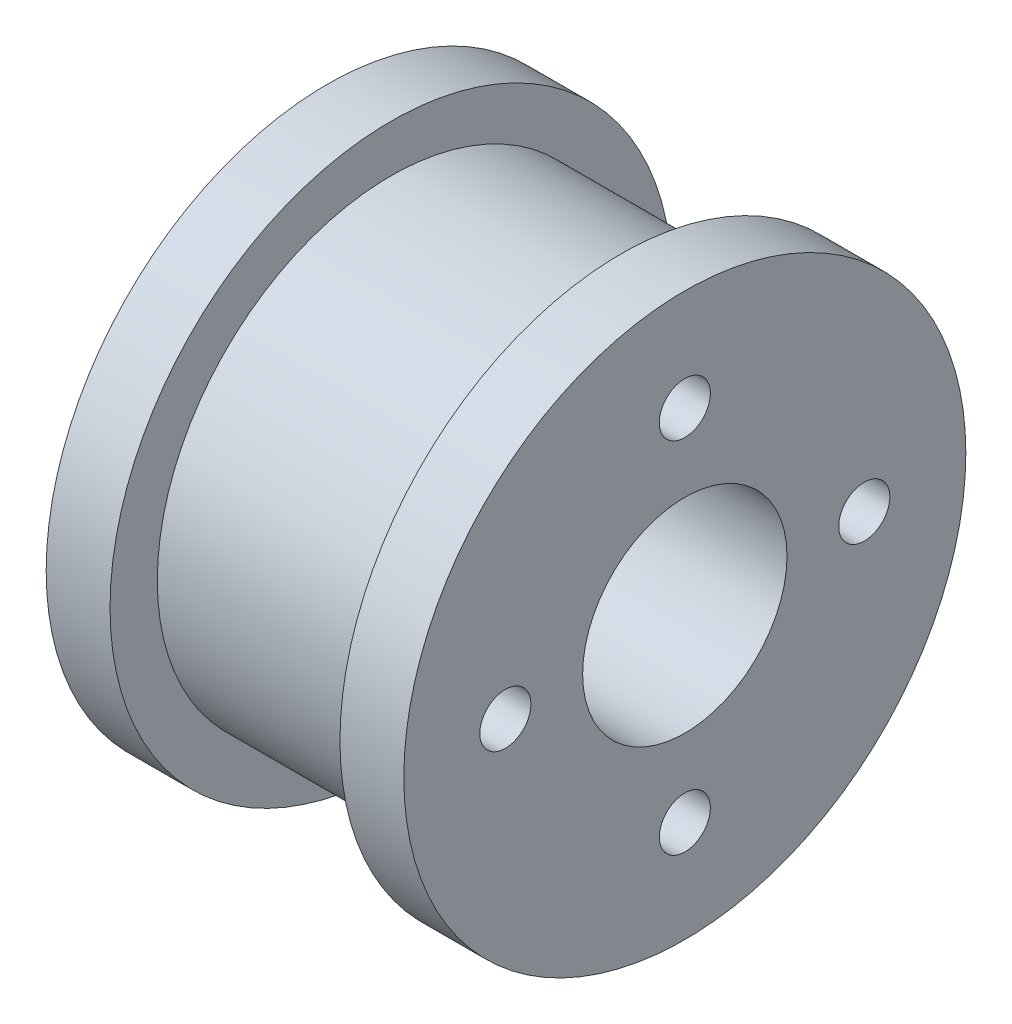
from build123d import *

# Parameters (mm, degrees)
SKETCH1_R           = 11
BOSS_EXTRUDE1_DEPTH = 2.5
SKETCH2_R           = 9.15
BOSS_EXTRUDE2_DEPTH = 9
SKETCH3_R           = 11
BOSS_EXTRUDE3_DEPTH = 2.5
SKETCH4_R           = 4
CUT_EXTRUDE1_DEPTH  = 21.928449536
CUT_EXTRUDE2_REACH  = 22.928
SKETCH5_R           = 1


with BuildPart() as part:
    # Sketch1 → Boss-Extrude1 (new body)
    with BuildSketch(Plane(origin=(0, 0, 0), x_dir=(0, 0, -1), z_dir=(1, 0, 0))):
        Circle(SKETCH1_R)
    extrude(amount=BOSS_EXTRUDE1_DEPTH)

    # Sketch2 → Boss-Extrude2 (add)
    with BuildSketch(Plane(origin=(2.5, 0, 0), x_dir=(0, 0, -1), z_dir=(1, 0, 0))):
        Circle(SKETCH2_R)
    extrude(amount=BOSS_EXTRUDE2_DEPTH)

    # Sketch3 → Boss-Extrude3 (add)
    with BuildSketch(Plane(origin=(11.5, 0, 0), x_dir=(0, 0, -1), z_dir=(1, 0, 0))):
        Circle(SKETCH3_R)
    extrude(amount=BOSS_EXTRUDE3_DEPTH)

    # Sketch4 → Cut-Extrude1 (cut, through all)
    with BuildSketch(Plane(origin=(14, 0, 0), x_dir=(0, 0, -1), z_dir=(1, 0, 0))):
        Circle(SKETCH4_R)
    extrude(amount=-CUT_EXTRUDE1_DEPTH, mode=Mode.SUBTRACT)

    # Sketch5 → Cut-Extrude2 (cut, up to next)
    with BuildSketch(Plane(origin=(14, 0, 0), x_dir=(0, 0, -1), z_dir=(1, 0, 0)), mode=Mode.PRIVATE) as cut_extrude2_sk1:
        with Locations((0, 7.025)):
            Circle(SKETCH5_R)
    cut_extrude2_tool1 = extrude(cut_extrude2_sk1.sketch, amount=-CUT_EXTRUDE2_REACH, mode=Mode.PRIVATE) & part.part
    # Sketch5 → Cut-Extrude2 (cut, up to next)
    with BuildSketch(Plane(origin=(14, 0, 0), x_dir=(0, 0, -1), z_dir=(1, 0, 0)), mode=Mode.PRIVATE) as cut_extrude2_sk2:
        with Locations((7.025, 0)):
            Circle(SKETCH5_R)
    cut_extrude2_tool2 = extrude(cut_extrude2_sk2.sketch, amount=-CUT_EXTRUDE2_REACH, mode=Mode.PRIVATE) & part.part
    # Sketch5 → Cut-Extrude2 (cut, up to next)
    with BuildSketch(Plane(origin=(14, 0, 0), x_dir=(0, 0, -1), z_dir=(1, 0, 0)), mode=Mode.PRIVATE) as cut_extrude2_sk3:
        with Locations((0, -7.025)):
            Circle(SKETCH5_R)
    cut_extrude2_tool3 = extrude(cut_extrude2_sk3.sketch, amount=-CUT_EXTRUDE2_REACH, mode=Mode.PRIVATE) & part.part
    # Sketch5 → Cut-Extrude2 (cut, up to next)
    with BuildSketch(Plane(origin=(14, 0, 0), x_dir=(0, 0, -1), z_dir=(1, 0, 0)), mode=Mode.PRIVATE) as cut_extrude2_sk4:
        with Locations((-7.025, 0)):
            Circle(SKETCH5_R)
    cut_extrude2_tool4 = extrude(cut_extrude2_sk4.sketch, amount=-CUT_EXTRUDE2_REACH, mode=Mode.PRIVATE) & part.part
    add(cut_extrude2_tool1.solids().sort_by_distance((14, 7.025, 0))[0], mode=Mode.SUBTRACT)
    add(cut_extrude2_tool2.solids().sort_by_distance((14, 0, -7.025))[0], mode=Mode.SUBTRACT)
    add(cut_extrude2_tool3.solids().sort_by_distance((14, -7.025, 0))[0], mode=Mode.SUBTRACT)
    add(cut_extrude2_tool4.solids().sort_by_distance((14, 0, 7.025))[0], mode=Mode.SUBTRACT)


solid = part.part
